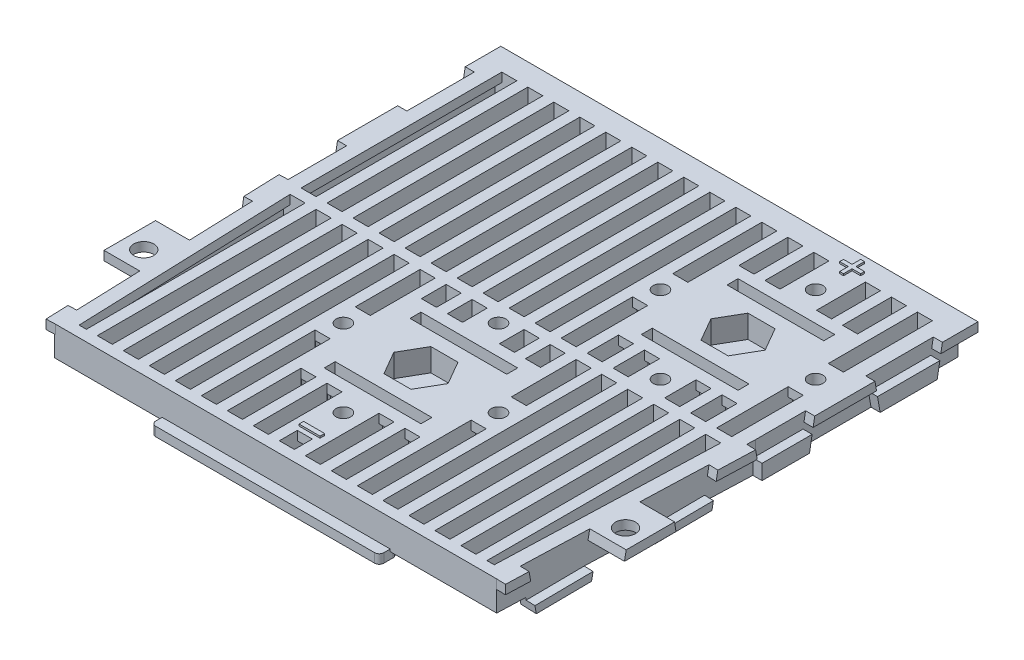
from build123d import *

# Parameters (mm, degrees)
SKETCH1_W                = 132.842
SKETCH1_H                = 128.9812
BOSS_EXTRUDE1_DEPTH      = 8.255
SKETCH2_R                = 2.032
CUT_EXTRUDE1_DEPTH       = 20.955
CUT_EXTRUDE2_DEPTH       = 6.35
SKETCH7_W                = 26.924
SKETCH7_H                = 3.048
CUT_EXTRUDE3_DEPTH       = 19.05
SKETCH8_W                = 4.191
SKETCH8_H                = 8.7376
SKETCH8_H_2              = 20.4978
SKETCH8_H_3              = 6.8834
SKETCH8_H_4              = 13.6144
SKETCH8_H_5              = 60.9092
SKETCH8_H_6              = 31.6738
SKETCH8_H_7              = 18.0594
SKETCH8_H_8              = 5.0038
CUT_EXTRUDE5_DEPTH       = 19.05
SKETCH9_W                = 4.191
SKETCH9_H                = 0.916921458
CUT_EXTRUDE7_DEPTH       = 5.715
BOSS_EXTRUDE2_DEPTH      = 1.905
BOSS_EXTRUDE2_DEPTH_BACK = 0.635
SKETCH11_W               = 6.096
SKETCH11_H               = 55.88
CUT_EXTRUDE8_DEPTH       = 5.715
SKETCH12_OUTSIDE_W       = 172.356
SKETCH12_OUTSIDE_H       = 171.544
CUT_EXTRUDE9_DEPTH       = 81.407
BOSS_EXTRUDE3_START      = -1.27
BOSS_EXTRUDE3_DEPTH      = 3.81
CUT_EXTRUDE10_DEPTH      = 1.905
BOSS_EXTRUDE4_DEPTH      = 2.54
BOSS_EXTRUDE5_DEPTH      = 1.9304
BOSS_EXTRUDE6_DEPTH      = 1.9304
BOSS_EXTRUDE7_REACH      = 97.376
SKETCH25_W               = 10.16
SKETCH25_H               = 2.54
CUT_EXTRUDE12_DEPTH      = 2.54
CUT_EXTRUDE13_REACH      = 156.638
SKETCH27_R               = 2.794
CUT_EXTRUDE14_DEPTH      = 2.54
MIRROR2_START            = 5.715
MIRROR2_OUTLINE_R        = 2.794
MIRROR2_DEPTH            = 2.54
MIRROR2_START_2          = -66.199136531
MIRROR2_2_DEPTH          = 2.54
CUT_EXTRUDE15_REACH      = 156.638
CUT_EXTRUDE16_DEPTH      = 2.54
BOSS_EXTRUDE8_DEPTH      = 0.508
SKETCH31_W               = 5.842
SKETCH31_H               = 1.27
BOSS_EXTRUDE9_DEPTH      = 0.508
BOSS_EXTRUDE10_DEPTH     = 2.54
BOSS_EXTRUDE11_DEPTH     = 1.9304


with BuildPart() as part:
    # Sketch1 → Boss-Extrude1 (new body)
    with BuildSketch(Plane(origin=(0, 0, 0), x_dir=(1, 0, 0), z_dir=(0, 1, 0))):
        Rectangle(SKETCH1_W, SKETCH1_H)
    extrude(amount=BOSS_EXTRUDE1_DEPTH)

    # Sketch2 → Cut-Extrude1 (cut)
    with BuildSketch(Plane(origin=(0, 8.255, 0), x_dir=(1, 0, 0), z_dir=(0, 1, 0))):
        with Locations(Location((36.0934, 49.6062, 0), (0, 0, 270))):
            Circle(SKETCH2_R)
        with Locations(Location((57.6834, 28.0162, 0), (0, 0, 270))):
            Circle(SKETCH2_R)
        with Locations(Location((36.0934, 6.4262, 0), (0, 0, 270))):
            Circle(SKETCH2_R)
        with Locations(Location((14.5034, 28.0162, 0), (0, 0, 270))):
            Circle(SKETCH2_R)
        with Locations(Location((0.0254, -2.5908, 0), (0, 0, 270))):
            Circle(SKETCH2_R)
        with Locations(Location((21.6154, -24.1808, 0), (0, 0, 270))):
            Circle(SKETCH2_R)
        with Locations(Location((0.0254, -45.7708, 0), (0, 0, 270))):
            Circle(SKETCH2_R)
        with Locations(Location((-21.5646, -24.1808, 0), (0, 0, 270))):
            Circle(SKETCH2_R)
    extrude(amount=-CUT_EXTRUDE1_DEPTH, mode=Mode.SUBTRACT)

    # Sketch6 → Cut-Extrude2 (cut)
    with BuildSketch(Plane(origin=(0, 8.255, 0), x_dir=(1, 0, 0), z_dir=(0, 1, 0))):
        Polygon((43.6372, 28.0162), (39.8653, 34.549322441), (32.3215, 34.549322441), (28.5496, 28.0162), (32.3215, 21.483077559), (39.8653, 21.483077559), align=None)
        Polygon((7.5692, -24.1808), (3.7973, -17.647677559), (-3.7465, -17.647677559), (-7.5184, -24.1808), (-3.7465, -30.713922441), (3.7973, -30.713922441), align=None)
    extrude(amount=-CUT_EXTRUDE2_DEPTH, mode=Mode.SUBTRACT)

    # Sketch7 → Cut-Extrude3 (cut)
    with BuildSketch(Plane(origin=(0, 8.255, 0), x_dir=(1, 0, 0), z_dir=(0, 1, 0))):
        with Locations((36.0934, 16.0782)):
            Rectangle(SKETCH7_W, SKETCH7_H)
        with Locations((36.0934, 39.9542)):
            Rectangle(SKETCH7_W, SKETCH7_H)
        with Locations((0.0254, -12.2428)):
            Rectangle(SKETCH7_W, SKETCH7_H)
        with Locations((0.0254, -36.1188)):
            Rectangle(SKETCH7_W, SKETCH7_H)
    extrude(amount=-CUT_EXTRUDE3_DEPTH, mode=Mode.SUBTRACT)

    # Sketch8 → Cut-Extrude5 (cut)
    with BuildSketch(Plane(origin=(0, 8.255, 0), x_dir=(1, 0, 0), z_dir=(0, 1, 0))):
        Polygon((55.6514, 2.5146), (59.8424, 2.5146), (59.8424, 22.4282), (55.6514, 22.4282), (55.6514, 11.2522), align=None)
        Polygon((16.5354, 44.7802), (16.5354, 33.6042), (12.3444, 33.6042), (12.3444, 58.3946), (16.5354, 58.3946), align=None)
        with Locations((21.6789, 6.8834)):
            Rectangle(SKETCH8_W, SKETCH8_H)
        Polygon((55.6514, 44.7802), (55.6514, 33.6042), (59.8424, 33.6042), (59.8424, 58.3946), (55.6514, 58.3946), align=None)
        with Locations((-14.5161, -51.1937)):
            Rectangle(SKETCH8_W, SKETCH8_H_2)
        with Locations((50.5079, 6.8834)):
            Rectangle(SKETCH8_W, SKETCH8_H)
        with Locations((-14.5161, -3.9751)):
            Rectangle(SKETCH8_W, SKETCH8_H_3)
        with Locations((21.6789, 51.5874)):
            Rectangle(SKETCH8_W, SKETCH8_H_4)
        with Locations((28.9179, 51.5874)):
            Rectangle(SKETCH8_W, SKETCH8_H_4)
        with Locations((43.2689, 51.5874)):
            Rectangle(SKETCH8_W, SKETCH8_H_4)
        Polygon((12.3444, 2.5146), (16.5354, 2.5146), (16.5354, 11.2522), (16.5354, 22.4282), (12.3444, 22.4282), align=None)
        with Locations((50.5079, 51.5874)):
            Rectangle(SKETCH8_W, SKETCH8_H_4)
        with Locations((28.9179, 6.8834)):
            Rectangle(SKETCH8_W, SKETCH8_H)
        with Locations((43.2689, 6.8834)):
            Rectangle(SKETCH8_W, SKETCH8_H)
        Polygon((5.1054, 58.3946), (5.1054, 2.5146), (9.2964, 2.5146), (9.2964, 11.2522), (9.2964, 44.7802), (9.2964, 58.3946), align=None)
        Polygon((-2.1336, 58.3946), (-2.1336, 2.5146), (2.0574, 2.5146), (2.0574, 11.2522), (2.0574, 44.7802), (2.0574, 58.3946), align=None)
        Polygon((-9.3726, 58.3946), (-9.3726, 2.5146), (-5.1816, 2.5146), (-5.1816, 11.2522), (-5.1816, 44.7802), (-5.1816, 58.3946), align=None)
        Polygon((-16.6116, 58.3946), (-16.6116, 2.5146), (-12.4206, 2.5146), (-12.4206, 11.2522), (-12.4206, 44.7802), (-12.4206, 58.3946), align=None)
        Polygon((-23.8506, 58.3946), (-23.8506, 2.5146), (-19.6596, 2.5146), (-19.6596, 11.2522), (-19.6596, 44.7802), (-19.6596, 58.3946), align=None)
        Polygon((-31.0896, 58.3946), (-31.0896, 2.5146), (-26.8986, 2.5146), (-26.8986, 11.2522), (-26.8986, 44.7802), (-26.8986, 58.3946), align=None)
        Polygon((-38.3286, 58.3946), (-38.3286, 2.5146), (-34.1376, 2.5146), (-34.1376, 11.2522), (-34.1376, 44.7802), (-34.1376, 58.3946), align=None)
        Polygon((-45.5676, 58.3946), (-45.5676, 2.5146), (-41.3766, 2.5146), (-41.3766, 11.2522), (-41.3766, 44.7802), (-41.3766, 58.3946), align=None)
        Polygon((-52.8066, 58.3946), (-52.8066, 2.5146), (-48.6156, 2.5146), (-48.6156, 11.2522), (-48.6156, 44.7802), (-48.6156, 58.3946), align=None)
        Polygon((-60.0456, 58.3946), (-60.0456, 2.5146), (-55.8546, 2.5146), (-55.8546, 11.2522), (-55.8546, 44.7802), (-55.8546, 58.3946), align=None)
        Polygon((55.6514, -0.5334), (55.6514, -61.4426), (57.6834, -61.4426), (59.8424, -0.5334), align=None)
        with Locations((50.5079, -30.988)):
            Rectangle(SKETCH8_W, SKETCH8_H_5)
        with Locations((43.2689, -30.988)):
            Rectangle(SKETCH8_W, SKETCH8_H_5)
        with Locations((36.0299, -30.988)):
            Rectangle(SKETCH8_W, SKETCH8_H_5)
        with Locations((28.7909, -30.988)):
            Rectangle(SKETCH8_W, SKETCH8_H_5)
        Polygon((-55.8546, -61.4426), (-55.8546, -0.5334), (-60.0456, -0.5334), (-57.8866, -61.4426), align=None)
        with Locations((-50.7111, -30.988)):
            Rectangle(SKETCH8_W, SKETCH8_H_5)
        with Locations((-43.4721, -30.988)):
            Rectangle(SKETCH8_W, SKETCH8_H_5)
        with Locations((-36.2331, -30.988)):
            Rectangle(SKETCH8_W, SKETCH8_H_5)
        with Locations((-28.9941, -30.988)):
            Rectangle(SKETCH8_W, SKETCH8_H_5)
        with Locations((-21.7551, -45.6057)):
            Rectangle(SKETCH8_W, SKETCH8_H_6)
        with Locations((-21.7551, -9.5631)):
            Rectangle(SKETCH8_W, SKETCH8_H_7)
        with Locations((-7.2771, -51.1937)):
            Rectangle(SKETCH8_W, SKETCH8_H_2)
        with Locations((-7.2771, -3.9751)):
            Rectangle(SKETCH8_W, SKETCH8_H_3)
        with Locations((-0.0381, -58.9407)):
            Rectangle(SKETCH8_W, SKETCH8_H_8)
        with Locations((7.2009, -51.1937)):
            Rectangle(SKETCH8_W, SKETCH8_H_2)
        with Locations((7.2009, -3.9751)):
            Rectangle(SKETCH8_W, SKETCH8_H_3)
        with Locations((14.4399, -51.1937)):
            Rectangle(SKETCH8_W, SKETCH8_H_2)
        with Locations((14.4399, -3.9751)):
            Rectangle(SKETCH8_W, SKETCH8_H_3)
        with Locations((21.6789, -45.6057)):
            Rectangle(SKETCH8_W, SKETCH8_H_6)
        with Locations((21.6789, -9.5631)):
            Rectangle(SKETCH8_W, SKETCH8_H_7)
    extrude(amount=-CUT_EXTRUDE5_DEPTH, mode=Mode.SUBTRACT)

    # Sketch9 → Cut-Extrude7 (cut)
    with BuildSketch(Plane.XZ):
        with Locations((43.2689, -44.321739271)):
            Rectangle(SKETCH9_W, SKETCH9_H)
        Polygon((26.8224, -30.965121458), (28.524957319, -30.965121458), (31.457896686, -36.045121458), (26.8224, -36.045121458), align=None)
        Polygon((26.8224, -25.067278482), (28.524957354, -25.067278482), (31.457896721, -19.987278482), (26.8224, -19.987278482), align=None)
        Polygon((45.3644, -36.045121458), (45.3644, -30.965121458), (43.661842681, -30.965121458), (40.728903314, -36.045121458), align=None)
        Polygon((43.661842646, -25.067278482), (40.728903279, -19.987278482), (45.3644, -19.987278482), (45.3644, -25.067278482), align=None)
        with BuildLine():
            Line((38.1254, -58.3946), (33.9344, -58.3946))
            Line((33.9344, -58.3946), (33.9344, -53.922331949))
            ThreePointArc((33.9344, -53.922331949), (36.022906251, -54.431685119), (38.1254, -53.983556737))
            Line((38.1254, -53.983556737), (38.1254, -58.3946))
        make_face()
        with BuildLine():
            Line((55.6514, -22.4282), (55.6514, -23.638843263))
            ThreePointArc((55.6514, -23.638843263), (57.753893749, -23.190714881), (59.8424, -23.700068051))
            Line((59.8424, -23.700068051), (59.8424, -22.4282))
            Line((59.8424, -22.4282), (55.6514, -22.4282))
        make_face()
        with BuildLine():
            Line((55.6514, -32.393556737), (55.6514, -33.6042))
            Line((55.6514, -33.6042), (59.8424, -33.6042))
            Line((59.8424, -33.6042), (59.8424, -32.332331949))
            ThreePointArc((59.8424, -32.332331949), (57.753893749, -32.841685119), (55.6514, -32.393556737))
        make_face()
        with BuildLine():
            Line((16.5354, -22.4282), (16.5354, -23.638843263))
            ThreePointArc((16.5354, -23.638843263), (14.432906251, -23.190714881), (12.3444, -23.700068051))
            Line((12.3444, -23.700068051), (12.3444, -22.4282))
            Line((12.3444, -22.4282), (16.5354, -22.4282))
        make_face()
        with BuildLine():
            Line((16.5354, -32.393556737), (16.5354, -33.6042))
            Line((16.5354, -33.6042), (12.3444, -33.6042))
            Line((12.3444, -33.6042), (12.3444, -32.332331949))
            ThreePointArc((12.3444, -32.332331949), (14.432906251, -32.841685119), (16.5354, -32.393556737))
        make_face()
        with BuildLine():
            Line((23.7744, -44.7802), (23.7744, -43.863278542))
            Line((23.7744, -43.863278542), (22.786321458, -43.863278542))
            ThreePointArc((22.786321458, -43.863278542), (20.990270234, -43.119329766), (20.246321458, -41.323278542))
            Line((20.246321458, -41.323278542), (20.246321458, -38.585121458))
            ThreePointArc((20.246321458, -38.585121458), (20.990270234, -36.789070234), (22.786321458, -36.045121458))
            Line((22.786321458, -36.045121458), (23.7744, -36.045121458))
            Line((23.7744, -36.045121458), (23.7744, -19.987278482))
            Line((23.7744, -19.987278482), (22.786321458, -19.987278482))
            ThreePointArc((22.786321458, -19.987278482), (20.990270234, -19.243329706), (20.246321458, -17.447278482))
            Line((20.246321458, -17.447278482), (20.246321458, -14.709121458))
            ThreePointArc((20.246321458, -14.709121458), (20.990270234, -12.913070234), (22.786321458, -12.169121458))
            Line((22.786321458, -12.169121458), (23.7744, -12.169121458))
            Line((23.7744, -12.169121458), (23.7744, -11.2522))
            Line((23.7744, -11.2522), (19.5834, -11.2522))
            Line((19.5834, -11.2522), (19.5834, -44.7802))
            Line((19.5834, -44.7802), (23.7744, -44.7802))
        make_face()
        with BuildLine():
            Line((48.4124, -44.7802), (48.4124, -43.863278542))
            Line((48.4124, -43.863278542), (49.400478542, -43.863278542))
            ThreePointArc((49.400478542, -43.863278542), (51.196529766, -43.119329766), (51.940478542, -41.323278542))
            Line((51.940478542, -41.323278542), (51.940478542, -38.585121458))
            ThreePointArc((51.940478542, -38.585121458), (51.196529766, -36.789070234), (49.400478542, -36.045121458))
            Line((49.400478542, -36.045121458), (48.4124, -36.045121458))
            Line((48.4124, -36.045121458), (48.4124, -19.987278482))
            Line((48.4124, -19.987278482), (49.400478542, -19.987278482))
            ThreePointArc((49.400478542, -19.987278482), (51.196529766, -19.243329706), (51.940478542, -17.447278482))
            Line((51.940478542, -17.447278482), (51.940478542, -14.709121458))
            ThreePointArc((51.940478542, -14.709121458), (51.196529766, -12.913070234), (49.400478542, -12.169121458))
            Line((49.400478542, -12.169121458), (48.4124, -12.169121458))
            Line((48.4124, -12.169121458), (48.4124, -11.2522))
            Line((48.4124, -11.2522), (52.6034, -11.2522))
            Line((52.6034, -11.2522), (52.6034, -44.7802))
            Line((52.6034, -44.7802), (48.4124, -44.7802))
        make_face()
        with BuildLine():
            Line((38.1254, -10.803556737), (38.1254, -12.169121458))
            Line((38.1254, -12.169121458), (33.9344, -12.169121458))
            Line((33.9344, -12.169121458), (33.9344, -10.742331949))
            ThreePointArc((33.9344, -10.742331949), (36.022906251, -11.251685119), (38.1254, -10.803556737))
        make_face()
        with BuildLine():
            Line((33.9344, -43.863278542), (33.9344, -45.290068051))
            ThreePointArc((33.9344, -45.290068051), (36.022906251, -44.780714881), (38.1254, -45.228843263))
            Line((38.1254, -45.228843263), (38.1254, -43.863278542))
            Line((38.1254, -43.863278542), (33.9344, -43.863278542))
        make_face()
        with Locations((28.9179, -11.710660729)):
            Rectangle(SKETCH9_W, SKETCH9_H)
        with Locations((43.2689, -11.710660729)):
            Rectangle(SKETCH9_W, SKETCH9_H)
        with Locations((28.9179, -44.321739271)):
            Rectangle(SKETCH9_W, SKETCH9_H)
        Polygon((-9.2456, 27.129721518), (-7.543042646, 27.129721518), (-4.610103279, 32.209721518), (-9.2456, 32.209721518), align=None)
        with BuildLine():
            Line((16.5354, 7.4168), (16.5354, 40.9448))
            Line((16.5354, 40.9448), (12.3444, 40.9448))
            Line((12.3444, 40.9448), (12.3444, 40.027878542))
            Line((12.3444, 40.027878542), (13.332478542, 40.027878542))
            ThreePointArc((13.332478542, 40.027878542), (15.128529766, 39.283929766), (15.872478542, 37.487878542))
            Line((15.872478542, 37.487878542), (15.872478542, 34.749721518))
            ThreePointArc((15.872478542, 34.749721518), (15.128529766, 32.953670294), (13.332478542, 32.209721518))
            Line((13.332478542, 32.209721518), (12.3444, 32.209721518))
            Line((12.3444, 32.209721518), (12.3444, 16.151878542))
            Line((12.3444, 16.151878542), (13.332478542, 16.151878542))
            ThreePointArc((13.332478542, 16.151878542), (15.128529766, 15.407929766), (15.872478542, 13.611878542))
            Line((15.872478542, 13.611878542), (15.872478542, 10.873721458))
            ThreePointArc((15.872478542, 10.873721458), (15.128529766, 9.077670234), (13.332478542, 8.333721458))
            Line((13.332478542, 8.333721458), (12.3444, 8.333721458))
            Line((12.3444, 8.333721458), (12.3444, 7.4168))
            Line((12.3444, 7.4168), (16.5354, 7.4168))
        make_face()
        with Locations((7.2009, 40.486339271)):
            Rectangle(SKETCH9_W, SKETCH9_H)
        Polygon((9.2964, 27.129721518), (9.2964, 32.209721518), (4.660903279, 32.209721518), (7.593842646, 27.129721518), align=None)
        with BuildLine():
            Line((-12.2936, 16.151878542), (-12.2936, 32.209721518))
            Line((-12.2936, 32.209721518), (-13.281678542, 32.209721518))
            ThreePointArc((-13.281678542, 32.209721518), (-15.077729766, 32.953670294), (-15.821678542, 34.749721518))
            Line((-15.821678542, 34.749721518), (-15.821678542, 37.487878542))
            ThreePointArc((-15.821678542, 37.487878542), (-15.077729766, 39.283929766), (-13.281678542, 40.027878542))
            Line((-13.281678542, 40.027878542), (-12.2936, 40.027878542))
            Line((-12.2936, 40.027878542), (-12.2936, 40.9448))
            Line((-12.2936, 40.9448), (-16.4846, 40.9448))
            Line((-16.4846, 40.9448), (-16.4846, 7.4168))
            Line((-16.4846, 7.4168), (-12.2936, 7.4168))
            Line((-12.2936, 7.4168), (-12.2936, 8.333721458))
            Line((-12.2936, 8.333721458), (-13.281678542, 8.333721458))
            ThreePointArc((-13.281678542, 8.333721458), (-15.077729766, 9.077670234), (-15.821678542, 10.873721458))
            Line((-15.821678542, 10.873721458), (-15.821678542, 13.611878542))
            ThreePointArc((-15.821678542, 13.611878542), (-15.077729766, 15.407929766), (-13.281678542, 16.151878542))
            Line((-13.281678542, 16.151878542), (-12.2936, 16.151878542))
        make_face()
        with Locations((-7.1501, 7.875260729)):
            Rectangle(SKETCH9_W, SKETCH9_H)
        Polygon((-7.543042681, 21.231878542), (-4.610103314, 16.151878542), (-9.2456, 16.151878542), (-9.2456, 21.231878542), align=None)
        Polygon((4.660903314, 16.151878542), (7.593842681, 21.231878542), (9.2964, 21.231878542), (9.2964, 16.151878542), align=None)
        with BuildLine():
            Line((19.5834, 19.803443263), (19.5834, 18.5928))
            Line((19.5834, 18.5928), (23.7744, 18.5928))
            Line((23.7744, 18.5928), (23.7744, 19.864668051))
            ThreePointArc((23.7744, 19.864668051), (21.685893749, 19.355314881), (19.5834, 19.803443263))
        make_face()
        with BuildLine():
            Line((-2.1336, 8.333721458), (2.0574, 8.333721458))
            Line((2.0574, 8.333721458), (2.0574, 6.968156737))
            ThreePointArc((2.0574, 6.968156737), (-0.045093749, 7.416285119), (-2.1336, 6.906931949))
            Line((-2.1336, 6.906931949), (-2.1336, 8.333721458))
        make_face()
        with Locations((7.2009, 7.875260729)):
            Rectangle(SKETCH9_W, SKETCH9_H)
        with BuildLine():
            Line((-23.7236, 28.496931949), (-23.7236, 29.7688))
            Line((-23.7236, 29.7688), (-19.5326, 29.7688))
            Line((-19.5326, 29.7688), (-19.5326, 28.558156737))
            ThreePointArc((-19.5326, 28.558156737), (-21.635093749, 29.006285119), (-23.7236, 28.496931949))
        make_face()
        with BuildLine():
            Line((2.0574, 40.027878542), (-2.1336, 40.027878542))
            Line((-2.1336, 40.027878542), (-2.1336, 41.454668051))
            ThreePointArc((-2.1336, 41.454668051), (-0.045093749, 40.945314881), (2.0574, 41.393443263))
            Line((2.0574, 41.393443263), (2.0574, 40.027878542))
        make_face()
        with Locations((-7.1501, 40.486339271)):
            Rectangle(SKETCH9_W, SKETCH9_H)
        with BuildLine():
            Line((-19.5326, 19.803443263), (-19.5326, 18.5928))
            Line((-19.5326, 18.5928), (-23.7236, 18.5928))
            Line((-23.7236, 18.5928), (-23.7236, 19.864668051))
            ThreePointArc((-23.7236, 19.864668051), (-21.635093749, 19.355314881), (-19.5326, 19.803443263))
        make_face()
        with BuildLine():
            Line((19.5834, 29.7688), (19.5834, 28.558156737))
            ThreePointArc((19.5834, 28.558156737), (21.685893749, 29.006285119), (23.7744, 28.496931949))
            Line((23.7744, 28.496931949), (23.7744, 29.7688))
            Line((23.7744, 29.7688), (19.5834, 29.7688))
        make_face()
        with BuildLine():
            Line((2.0574, 56.4388), (-2.1336, 56.4388))
            Line((-2.1336, 56.4388), (-2.1336, 50.086931949))
            ThreePointArc((-2.1336, 50.086931949), (-0.045093749, 50.596285119), (2.0574, 50.148156737))
            Line((2.0574, 50.148156737), (2.0574, 56.4388))
        make_face()
    extrude(amount=-CUT_EXTRUDE7_DEPTH, mode=Mode.SUBTRACT)

    # Sketch10 → Boss-Extrude2 (add, two sides: drawn at the far end of the back side and taken through both)
    with BuildSketch(Plane.XZ.offset(-BOSS_EXTRUDE2_DEPTH_BACK)):
        with BuildLine():
            Line((30.5054, 67.5386), (-30.4546, 67.5386))
            ThreePointArc((-30.4546, 67.5386), (-31.352625612, 67.166625612), (-31.7246, 66.2686))
            Line((-31.7246, 66.2686), (-31.7246, 63.7286))
            ThreePointArc((-31.7246, 63.7286), (-31.352625612, 62.830574388), (-30.4546, 62.4586))
            Line((-30.4546, 62.4586), (30.5054, 62.4586))
            ThreePointArc((30.5054, 62.4586), (31.403425612, 62.830574388), (31.7754, 63.7286))
            Line((31.7754, 63.7286), (31.7754, 66.2686))
            ThreePointArc((31.7754, 66.2686), (31.403425612, 67.166625612), (30.5054, 67.5386))
        make_face()
    extrude(amount=BOSS_EXTRUDE2_DEPTH + BOSS_EXTRUDE2_DEPTH_BACK)

    # Sketch11 → Cut-Extrude8 (cut)
    with BuildSketch(Plane.XZ):
        Polygon((61.7474, -61.4426), (-75.21120249, -61.4426), (-75.21120249, -66.838099972), (72.650205149, -66.838099972), (72.650205149, -61.4426), align=None)
        Polygon((-61.949404374, 0.60088264), (-61.951796377, 0.5334), (-55.8546, 0.5334), (-55.8546, 61.4426), (-59.792796377, 61.4426), align=None)
        with BuildLine():
            Line((61.7474, -25.413474505), (61.7474, -5.071911397))
            Line((61.7474, -5.071911397), (61.7474, -2.5146))
            Line((61.7474, -2.5146), (55.6514, -2.5146))
            Line((55.6514, -2.5146), (55.6514, -23.638843263))
            ThreePointArc((55.6514, -23.638843263), (59.032319943, -23.382552302), (61.7474, -25.413474505))
        make_face()
        with BuildLine():
            Line((61.7474, -32.393556737), (61.7474, -58.3946))
            Line((61.7474, -58.3946), (55.6514, -58.3946))
            Line((55.6514, -58.3946), (55.6514, -32.393556737))
            ThreePointArc((55.6514, -32.393556737), (59.032319943, -32.649847698), (61.7474, -30.618925495))
            Line((61.7474, -30.618925495), (61.7474, -32.393556737))
        make_face()
        with Locations((-58.9026, -30.4546)):
            Rectangle(SKETCH11_W, SKETCH11_H)
        Polygon((55.6514, 0.5334), (61.748596377, 0.5334), (61.746204374, 0.60088264), (59.589596377, 61.4426), (55.6514, 61.4426), align=None)
    extrude(amount=-CUT_EXTRUDE8_DEPTH, mode=Mode.SUBTRACT)

    # Sketch12 outside → Cut-Extrude9 (cut)
    with BuildSketch(Plane(origin=(0, 8.255, 0), x_dir=(1, 0, 0), z_dir=(0, 1, 0))):
        with Locations((0, -1.524)):
            Rectangle(SKETCH12_OUTSIDE_W, SKETCH12_OUTSIDE_H)
        Polygon((63.675392806, -0.669265049), (63.881, 5.131276739), (63.881, 61.9506), (63.881, 78.793969957), (-63.881, 78.793969957), (-63.881, 61.9506), (-63.881, -0.601353849), (-63.878592806, -0.669265049), (-61.719592806, -61.578465049), (-61.254630132, -74.695882596), (61.051430132, -74.695882596), (61.516392806, -61.578465049), align=None, mode=Mode.SUBTRACT)
    extrude(amount=-CUT_EXTRUDE9_DEPTH, mode=Mode.SUBTRACT)

    # Sketch13 → Boss-Extrude3 (add)
    with BuildSketch(Plane(origin=(63.881, 0, 0), x_dir=(0, 0, -1), z_dir=(1, 0, 0)).offset(BOSS_EXTRUDE3_START)):
        Polygon((64.4906, 5.715), (54.136729469, 5.715), (54.5846, 8.255), (64.4906, 8.255), align=None)
        Polygon((53.86800715, 4.191), (36.515034398, 4.191), (37.254020774, 0), (53.129020774, 0), align=None)
        Polygon((36.24631208, 5.715), (35.798441549, 8.255), (19.034441549, 8.255), (18.586571018, 5.715), align=None)
        Polygon((18.317848699, 4.191), (17.578862323, 0), (4.370862323, 0), (3.631875947, 4.191), align=None)
    boss_extrude3 = extrude(amount=BOSS_EXTRUDE3_DEPTH)

    # Mirror1: Boss-Extrude3 across plane
    add(boss_extrude3.mirror(Plane(origin=(0, 0, 0), x_dir=(0, 0, 1), z_dir=(1, 0, 0))))

    # Sketch15 → Cut-Extrude10 (cut)
    with BuildSketch(Plane.XZ):
        with BuildLine():
            Line((61.7474, -53.129020774), (61.7474, -37.254020774))
            ThreePointArc((61.7474, -37.254020774), (62.372316972, -38.762703803), (63.881, -39.387620774))
            Line((63.881, -39.387620774), (63.881, -50.995420774))
            ThreePointArc((63.881, -50.995420774), (62.372316972, -51.620337746), (61.7474, -53.129020774))
        make_face()
        with BuildLine():
            Line((61.7474, -17.578862323), (61.7474, -4.370862323))
            ThreePointArc((61.7474, -4.370862323), (62.372316972, -5.879545351), (63.881, -6.504462323))
            Line((63.881, -6.504462323), (63.881, -15.445262323))
            ThreePointArc((63.881, -15.445262323), (62.372316972, -16.070179294), (61.7474, -17.578862323))
        make_face()
        with BuildLine():
            Line((-63.881, -39.387620774), (-63.881, -50.995420774))
            ThreePointArc((-63.881, -50.995420774), (-62.372316972, -51.620337746), (-61.7474, -53.129020774))
            Line((-61.7474, -53.129020774), (-61.7474, -37.254020774))
            ThreePointArc((-61.7474, -37.254020774), (-62.372316972, -38.762703803), (-63.881, -39.387620774))
        make_face()
        with BuildLine():
            Line((-63.881, -6.504462323), (-63.881, -15.445262323))
            ThreePointArc((-63.881, -15.445262323), (-62.372316972, -16.070179294), (-61.7474, -17.578862323))
            Line((-61.7474, -17.578862323), (-61.7474, -4.370862323))
            ThreePointArc((-61.7474, -4.370862323), (-62.372316972, -5.879545351), (-63.881, -6.504462323))
        make_face()
    extrude(amount=-CUT_EXTRUDE10_DEPTH, mode=Mode.SUBTRACT)

    # Sketch18 → Boss-Extrude4 (add)
    with BuildSketch(Plane(origin=(63.619182442, 0, 2.255058594), x_dir=(0.0354239582335073, 0, -0.9993723746347358), z_dir=(0.9993723746347359, 0, 0.0354239582335073))):
        Polygon((5.463560892, 5.715), (-5.59218017, 5.715), (-5.144309639, 8.255), (5.015690361, 8.255), align=None)
        Polygon((-62.274626542, 8.255), (-55.924626542, 8.255), (-55.476756011, 5.715), (-62.274626542, 5.715), align=None)
        Polygon((-37.26546809, 8.255), (-23.80346809, 8.255), (-23.355597559, 5.715), (-37.713338621, 5.715), align=None)
        Polygon((-39.105205505, -2.178669351), (-53.96590012, -2.853489545), (-54.343955296, -0.7094321), (-38.721047316, 0), align=None)
        Polygon((-22.477946743, 0.737594881), (-22.099891567, -1.406462564), (-6.724778224, -0.708282753), (-6.340620035, 1.470386599), align=None)
    extrude(amount=BOSS_EXTRUDE4_DEPTH)


with BuildPart() as boss_extrude4_piece_1:
    # of the separate pieces the step leaves, piece 1, a body of its own (boss_extrude4_pieces)
    add(part.part.solids().sort_by_distance((66.421, 8.255, -64.4906))[0])



with BuildPart() as boss_extrude4_piece_2:
    # of the separate pieces the step leaves, piece 2, a body of its own (boss_extrude4_pieces)
    add(part.part.solids().sort_by_distance((62.233921276, -2.178669351, 41.335720679))[0])


with BuildPart() as boss_extrude4_piece_1_1:
    add(boss_extrude4_piece_1.part)

    add(boss_extrude4_piece_2.part)  # Boss-Extrude5 merges Boss-Extrude4 piece 2
    # Sketch20 → Boss-Extrude5 (add)
    with BuildSketch(Plane(origin=(63.619182442, 0, 2.255058594), x_dir=(-0.035423958233507434, 0, 0.9993723746347358), z_dir=(-0.9993723746347359, -1.5140131380344863e-15, -0.035423958233507434))):
        Polygon((53.96590012, -2.853489545), (54.343955296, -0.7094321), (54.719185807, 1.418605876), (38.721047316, 1.418605876), (38.721047316, 0), (39.105205505, -2.178669351), align=None)
    extrude(amount=BOSS_EXTRUDE5_DEPTH)

    # Sketch21 → Boss-Extrude6 (add)
    with BuildSketch(Plane(origin=(63.619182442, 0, 2.255058594), x_dir=(-0.035423958233507274, 0, 0.9993723746347358), z_dir=(-0.9993723746347359, 4.696851849361749e-15, -0.035423958233507274))):
        Polygon((22.099891567, -1.406462564), (22.347888864, 0), (22.497330504, 0.847525656), (6.517732407, 0.423762828), (6.599888864, 0), (6.724778224, -0.708282753), align=None)
    extrude(amount=BOSS_EXTRUDE6_DEPTH)

    # Boss-Extrude7: up to this face of the body (flat: up to its plane)
    boss_extrude7_end = Plane(boss_extrude4_piece_1_1.part.faces().sort_by_distance((63.806733636, 5.715, 32.815350904))[0])
    # Sketch24 → Boss-Extrude7 (add, up to the picked face)
    with BuildSketch(Plane(origin=(0, 8.255, 0), x_dir=(1, 0, 0), z_dir=(0, 1, 0)), mode=Mode.PRIVATE) as boss_extrude7_sk1:
        Polygon((62.79183473, -25.595997587), (72.44322671, -25.595997587), (72.44322671, -39.944727367), (62.28322671, -39.944727367), align=None)
    boss_extrude7_tool1 = split(extrude(boss_extrude7_sk1.sketch, amount=-BOSS_EXTRUDE7_REACH, mode=Mode.PRIVATE), bisect_by=boss_extrude7_end, keep=Keep.BOTH, mode=Mode.PRIVATE)
    add(boss_extrude7_tool1.solids().sort_by(Axis((67.489291, 8.255, 32.831757), (0, -1, 0)))[0])

    # Sketch25 → Cut-Extrude12 (cut)
    with BuildSketch(Plane.XY.offset(39.944727367)):
        with Locations((67.36322671, 6.985)):
            Rectangle(SKETCH25_W, SKETCH25_H)
    extrude(amount=CUT_EXTRUDE12_DEPTH, mode=Mode.SUBTRACT)

    # Cut-Extrude13: up to this plane
    cut_extrude13_end = Plane(origin=(63.675392806, -73.152, 0.669265049), z_dir=(0.9993723746347358, 0, 0.035423958233507295))
    # Sketch26 → Cut-Extrude13 (cut, up to the surface)
    with BuildSketch(Plane(origin=(72.44322671, 0, 0), x_dir=(0, 0, -1), z_dir=(1, 0, 0)), mode=Mode.PRIVATE) as cut_extrude13_sk1:
        Polygon((-39.944727367, 5.715), (-39.457148218, 8.255), (-25.997671289, 8.255), (-25.595997587, 5.715), (-25.595997587, 4.277411519), (-23.975053419, 4.277411519), (-23.975053419, 9.900907771), (-42.573925103, 9.900907771), (-42.573925103, 4.277411519), (-39.944727367, 4.277411519), align=None)
    cut_extrude13_tool1 = split(extrude(cut_extrude13_sk1.sketch, amount=-CUT_EXTRUDE13_REACH, mode=Mode.PRIVATE), bisect_by=cut_extrude13_end, keep=Keep.BOTH, mode=Mode.PRIVATE)
    add(cut_extrude13_tool1.solids().sort_by_distance((72.443227, 7.02163, 39.891758))[0], mode=Mode.SUBTRACT)

    # Sketch27 → Cut-Extrude14 (cut)
    with BuildSketch(Plane(origin=(0, 8.255, 0), x_dir=(1, 0, 0), z_dir=(0, 1, 0))):
        with Locations(Location((67.056, -34.2646, 0), (0, 0, 270))):
            Circle(SKETCH27_R)
    extrude(amount=-CUT_EXTRUDE14_DEPTH, mode=Mode.SUBTRACT)

    # Mirror2: read off the stored shape, not the designer's step
    # Mirror2 outline → Mirror2 (add)
    with BuildSketch(Plane(origin=(0, 0, 0), x_dir=(1, 0, 0), z_dir=(0, 1, 0)).offset(MIRROR2_START)):
        Polygon((-72.44322671, -39.944727367), (-62.48642671, -39.944727367), (-62.99503473, -25.595997587), (-72.44322671, -25.595997587), align=None)
        with Locations((-67.056, -34.2646)):
            Circle(MIRROR2_OUTLINE_R, mode=Mode.SUBTRACT)
    extrude(amount=MIRROR2_DEPTH)

    # Mirror2 2 outline → Mirror2 2 (add)
    with BuildSketch(Plane(origin=(0, 0, 0), x_dir=(0, 1, 0), z_dir=(0.9993723746347358, 0, -0.03542395823350719)).offset(MIRROR2_START_2)):
        Polygon((5.715, 37.62330526), (6.225604564, 37.62330526), (5.715, 37.713338621), align=None)
        Polygon((5.715, 55.476756011), (8.255, 55.924626542), (8.255, 62.274626542), (5.715, 62.274626542), align=None)
        Polygon((8.255, 5.144309639), (5.715, 5.59218017), (5.715, -5.463560892), (8.255, -5.015690361), align=None)
        Polygon((-0.708282753, 6.724778224), (1.470386599, 6.340620035), (0.737594881, 22.477946743), (-1.406462564, 22.099891567), align=None)
    extrude(amount=MIRROR2_2_DEPTH)

    # Cut-Extrude15: up to this plane
    cut_extrude15_end = Plane(origin=(63.675392806, -73.152, 0.669265049), z_dir=(0.9993723746347358, 0, 0.035423958233507295))
    # Sketch28 → Cut-Extrude15 (cut, up to the surface)
    with BuildSketch(Plane(origin=(66.421, 0, 0), x_dir=(0, 0, -1), z_dir=(1, 0, 0)), mode=Mode.PRIVATE) as cut_extrude15_sk1:
        Polygon((4.370862323, 0), (4.381576343, 4.191), (4.381576343, 4.960372875), (2.345843666, 4.960372875), (2.345843666, 0), align=None)
    cut_extrude15_tool1 = split(extrude(cut_extrude15_sk1.sketch, amount=-CUT_EXTRUDE15_REACH, mode=Mode.PRIVATE), bisect_by=cut_extrude15_end, keep=Keep.BOTH, mode=Mode.PRIVATE)
    add(cut_extrude15_tool1.solids().sort_by_distance((66.421, 2.4826, -3.36145))[0], mode=Mode.SUBTRACT)

    # Sketch29 → Cut-Extrude16 (cut)
    with BuildSketch(Plane.ZY.offset(66.421)):
        Polygon((-4.370862323, 0), (-4.370862323, 4.74234696), (-1.790780857, 4.74234696), (-1.884754237, 0), align=None)
    extrude(amount=-CUT_EXTRUDE16_DEPTH, mode=Mode.SUBTRACT)



with BuildPart() as body_2:
    # Sketch30 → Boss-Extrude8 (new body)
    with BuildSketch(Plane(origin=(0, 8.255, 0), x_dir=(1, 0, 0), z_dir=(0, 1, 0))):
        Polygon((35.56, 62.6872), (35.56, 60.2996), (33.1724, 60.2996), (33.1724, 59.2328), (35.56, 59.2328), (35.56, 56.8452), (36.6268, 56.8452), (36.6268, 59.2328), (39.0144, 59.2328), (39.0144, 60.2996), (36.6268, 60.2996), (36.6268, 62.6872), align=None)
    extrude(amount=BOSS_EXTRUDE8_DEPTH)


with BuildPart() as body_3:
    # Sketch31 → Boss-Extrude9 (new body)
    with BuildSketch(Plane(origin=(0, 8.255, 0), x_dir=(1, 0, 0), z_dir=(0, 1, 0))):
        with Locations((0, -54.5338)):
            Rectangle(SKETCH31_W, SKETCH31_H)
    extrude(amount=BOSS_EXTRUDE9_DEPTH)


with BuildPart() as body_4:
    # Sketch32 → Boss-Extrude10 (new body)
    with BuildSketch(Plane(origin=(-63.822127455, 0, 2.262252224), x_dir=(0.03542395823350833, 0, 0.9993723746347358), z_dir=(-0.9993723746347358, 0, 0.03542395823350833))):
        Polygon((43.310995863, 0), (43.694189925, -2.178669351), (58.517588452, -2.853489545), (58.894694818, -0.7094321), align=None)
    extrude(amount=BOSS_EXTRUDE10_DEPTH)


with BuildPart() as boss_extrude4_piece_1_2:
    add(boss_extrude4_piece_1_1.part)

    add(body_4.part)  # Boss-Extrude11 merges body 4
    # Sketch35 → Boss-Extrude11 (add)
    with BuildSketch(Plane(origin=(-63.822127455, 0, 2.262252224), x_dir=(-0.03542395823350851, 0, -0.9993723746347358), z_dir=(0.9993723746347358, 0, -0.03542395823350851))):
        Polygon((-43.694189925, -2.178669351), (-43.310995863, 0), (-43.075359385, 1.339723199), (-59.255109371, 1.339723199), (-58.894694818, -0.7094321), (-58.517588452, -2.853489545), align=None)
    extrude(amount=BOSS_EXTRUDE11_DEPTH)


solid = Compound([body_2.part, body_3.part, boss_extrude4_piece_1_2.part])
